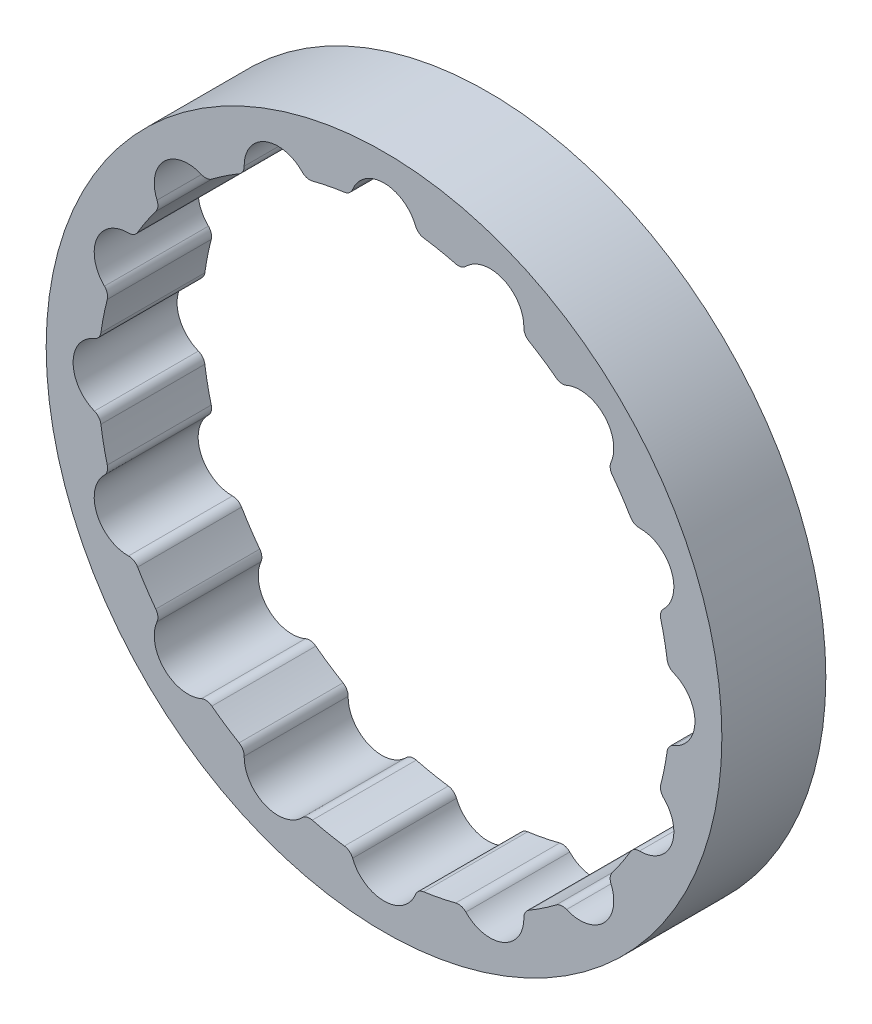
from build123d import *

# Parameters (mm, degrees)
SKETCH1_R           = 32.5
BOSS_EXTRUDE1_DEPTH = 10
FILLET1_R           = 1


with BuildPart() as part:
    # Sketch1 → Boss-Extrude1 (new body)
    with BuildSketch(Plane.XY):
        Circle(SKETCH1_R)
        with BuildLine():
            ThreePointArc((-7.512266377, 26.454032847), (-5.364983855, 26.971595211), (-3.183090941, 27.315159382))
            ThreePointArc((-3.183090941, 27.315159382), (0, 29.909086169), (3.183090941, 27.315159382))
            ThreePointArc((3.183090941, 27.315159382), (5.364983855, 26.971595211), (7.512266377, 26.454032847))
            ThreePointArc((7.512266377, 26.454032847), (11.445711754, 27.632392548), (13.393851518, 24.017800513))
            ThreePointArc((13.393851518, 24.017800513), (15.278181408, 22.865414338), (17.063949239, 21.565519618))
            ThreePointArc((17.063949239, 21.565519618), (21.148917649, 21.148917649), (21.565519618, 17.063949239))
            ThreePointArc((21.565519618, 17.063949239), (22.865414338, 15.278181408), (24.017800513, 13.393851518))
            ThreePointArc((24.017800513, 13.393851518), (27.632392548, 11.445711754), (26.454032847, 7.512266377))
            ThreePointArc((26.454032847, 7.512266377), (26.971595211, 5.364983855), (27.315159382, 3.183090941))
            ThreePointArc((27.315159382, 3.183090941), (29.909086169, 0), (27.315159382, -3.183090941))
            ThreePointArc((27.315159382, -3.183090941), (26.971595211, -5.364983855), (26.454032847, -7.512266377))
            ThreePointArc((26.454032847, -7.512266377), (27.632392548, -11.445711754), (24.017800513, -13.393851518))
            ThreePointArc((24.017800513, -13.393851518), (22.865414338, -15.278181408), (21.565519618, -17.063949239))
            ThreePointArc((21.565519618, -17.063949239), (21.148917649, -21.148917649), (17.063949239, -21.565519618))
            ThreePointArc((17.063949239, -21.565519618), (15.278181408, -22.865414338), (13.393851518, -24.017800513))
            ThreePointArc((13.393851518, -24.017800513), (11.445711754, -27.632392548), (7.512266377, -26.454032847))
            ThreePointArc((7.512266377, -26.454032847), (5.364983855, -26.971595211), (3.183090941, -27.315159382))
            ThreePointArc((3.183090941, -27.315159382), (0, -29.909086169), (-3.183090941, -27.315159382))
            ThreePointArc((-3.183090941, -27.315159382), (-5.364983855, -26.971595211), (-7.512266377, -26.454032847))
            ThreePointArc((-7.512266377, -26.454032847), (-11.445711754, -27.632392548), (-13.393851518, -24.017800513))
            ThreePointArc((-13.393851518, -24.017800513), (-15.278181408, -22.865414338), (-17.063949239, -21.565519618))
            ThreePointArc((-17.063949239, -21.565519618), (-21.148917649, -21.148917649), (-21.565519618, -17.063949239))
            ThreePointArc((-21.565519618, -17.063949239), (-22.865414338, -15.278181408), (-24.017800513, -13.393851518))
            ThreePointArc((-24.017800513, -13.393851518), (-27.632392548, -11.445711754), (-26.454032847, -7.512266377))
            ThreePointArc((-26.454032847, -7.512266377), (-26.971595211, -5.364983855), (-27.315159382, -3.183090941))
            ThreePointArc((-27.315159382, -3.183090941), (-29.909086169, 0), (-27.315159382, 3.183090941))
            ThreePointArc((-27.315159382, 3.183090941), (-26.971595211, 5.364983855), (-26.454032847, 7.512266377))
            ThreePointArc((-26.454032847, 7.512266377), (-27.632392548, 11.445711754), (-24.017800513, 13.393851518))
            ThreePointArc((-24.017800513, 13.393851518), (-22.865414338, 15.278181408), (-21.565519618, 17.063949239))
            ThreePointArc((-21.565519618, 17.063949239), (-21.148917649, 21.148917649), (-17.063949239, 21.565519618))
            ThreePointArc((-17.063949239, 21.565519618), (-15.278181408, 22.865414338), (-13.393851518, 24.017800513))
            ThreePointArc((-13.393851518, 24.017800513), (-11.445711754, 27.632392548), (-7.512266377, 26.454032847))
        make_face(mode=Mode.SUBTRACT)
    extrude(amount=BOSS_EXTRUDE1_DEPTH)

    # Fillet1
    fillet1_edges = [part.edges().sort_by_distance(p)[0] for p in [
        (3.183090941, 27.315159382, 5),
        (-3.183090941, 27.315159382, 5),
        (-7.512266377, 26.454032847, 5),
        (-13.393851518, 24.017800513, 5),
        (-17.063949239, 21.565519618, 5),
        (-21.565519618, 17.063949239, 5),
        (-24.017800513, 13.393851518, 5),
        (-26.454032847, 7.512266377, 5),
        (-27.315159382, 3.183090941, 5),
        (-26.454032847, -7.512266377, 5),
        (-24.017800513, -13.393851518, 5),
        (-21.565519618, -17.063949239, 5),
        (-17.063949239, -21.565519618, 5),
        (-13.393851518, -24.017800513, 5),
        (-7.512266377, -26.454032847, 5),
        (-3.183090941, -27.315159382, 5),
        (3.183090941, -27.315159382, 5),
        (7.512266377, -26.454032847, 5),
        (13.393851518, -24.017800513, 5),
        (17.063949239, -21.565519618, 5),
        (21.565519618, -17.063949239, 5),
        (24.017800513, -13.393851518, 5),
        (26.454032847, -7.512266377, 5),
        (27.315159382, -3.183090941, 5),
        (27.315159382, 3.183090941, 5),
        (26.454032847, 7.512266377, 5),
        (24.017800513, 13.393851518, 5),
        (21.565519618, 17.063949239, 5),
        (17.063949239, 21.565519618, 5),
        (13.393851518, 24.017800513, 5),
        (7.512266377, 26.454032847, 5),
        (-27.315159382, -3.183090941, 5),
    ]]
    fillet(fillet1_edges, radius=FILLET1_R)


solid = part.part
